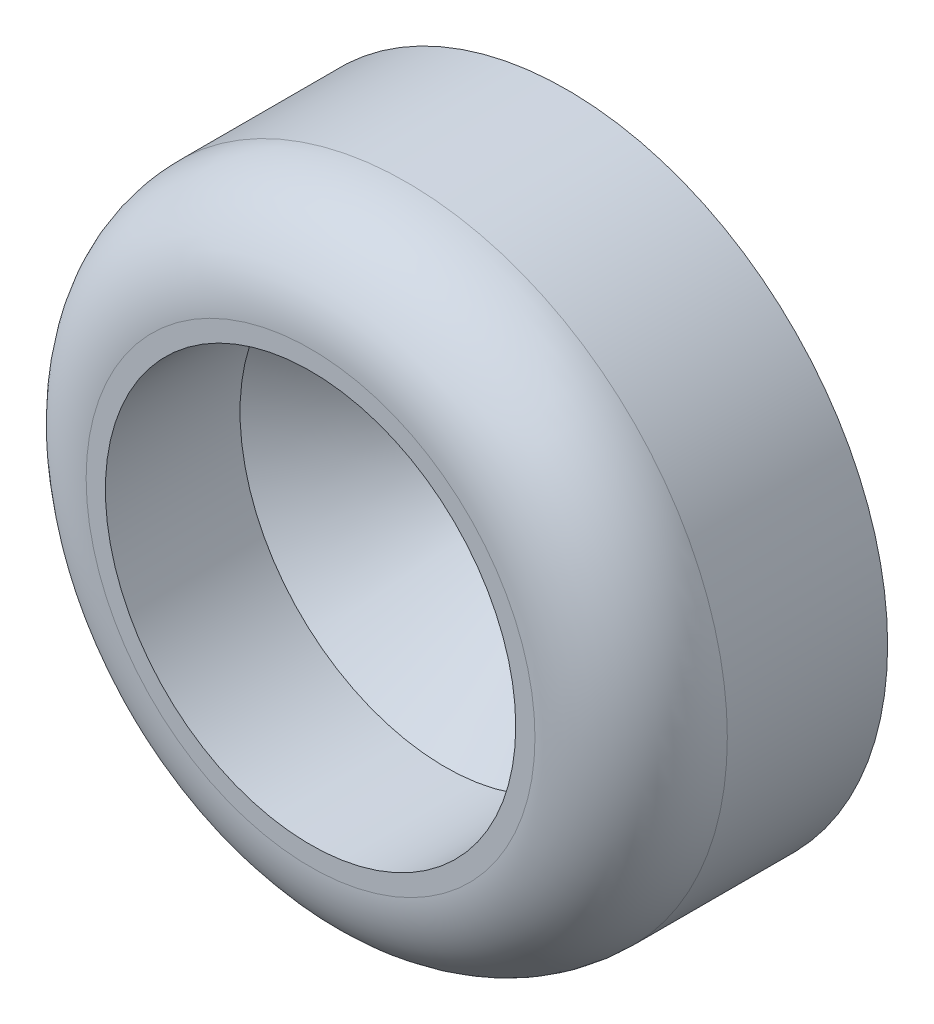
from build123d import *

# Parameters (mm, degrees)
SKETCH1_R           = 5
SKETCH1_R_2         = 1.6
BOSS_EXTRUDE1_DEPTH = 4
SKETCH2_R           = 3.2
CUT_EXTRUDE1_DEPTH  = 1.9
CHAMFER1_SIZE       = 1.8
FILLET1_R           = 1.5


with BuildPart() as part:
    # Sketch1 → Boss-Extrude1 (new body)
    with BuildSketch(Plane.XY):
        Circle(SKETCH1_R)
        Circle(SKETCH1_R_2, mode=Mode.SUBTRACT)
    extrude(amount=BOSS_EXTRUDE1_DEPTH)

    # Sketch2 → Cut-Extrude1 (cut)
    with BuildSketch(Plane.XY.offset(4)):
        Circle(SKETCH2_R)
    extrude(amount=-CUT_EXTRUDE1_DEPTH, mode=Mode.SUBTRACT)

    # Chamfer1
    # the kernel refuses this chamfer: 1.8 mm, written as the material it takes off along each edge
    with BuildSketch(Plane(origin=(0, 0, 2.1), x_dir=(1, 0, 0), z_dir=(0, 1, 0))) as chamfer1_piece_1_section:
        Polygon((1.6, CHAMFER1_SIZE), (1.6 + CHAMFER1_SIZE, 0), (1.6, 0), align=None)
    chamfer1_piece_1 = revolve(axis=Axis((0, 0, 2.1), (0, 0, -1)), mode=Mode.PRIVATE)
    chamfer1_piece_1 = chamfer1_piece_1 & Plane(origin=(0, 0, 1.094879123), x_dir=(1, 0, 0), z_dir=(0, 0, 1)) * Cylinder(3.2, 14, mode=Mode.PRIVATE)
    add(chamfer1_piece_1, mode=Mode.SUBTRACT)

    # Fillet1
    fillet1_edges = [part.edges().sort_by_distance(p)[0] for p in [
        (-5, 0, 4),
    ]]
    fillet(fillet1_edges, radius=FILLET1_R)


solid = part.part
